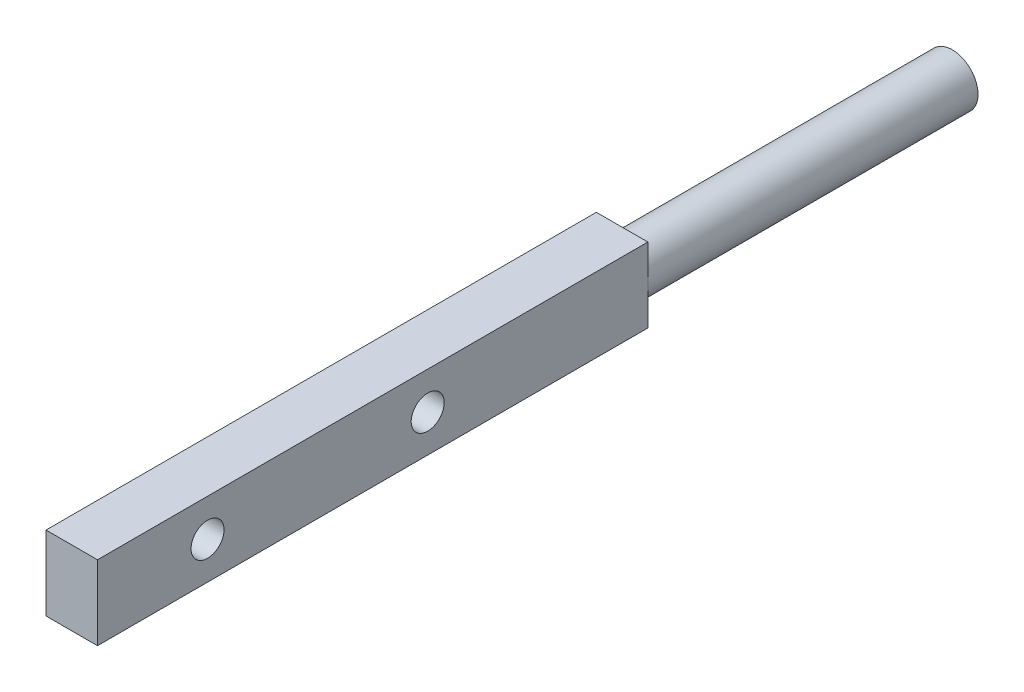
from build123d import *

# Parameters (mm, degrees)
SKETCH1_W           = 4.67766733
SKETCH1_H           = 6.76462661
BOSS_EXTRUDE1_DEPTH = 50
SKETCH2_R           = 2.338833665
BOSS_EXTRUDE2_DEPTH = 30
SKETCH3_R           = 1.5
CUT_EXTRUDE1_DEPTH  = 51.671893046


with BuildPart() as part:
    # Sketch1 → Boss-Extrude1 (new body)
    with BuildSketch(Plane.XY):
        with Locations((2.338833665, 3.382313305)):
            Rectangle(SKETCH1_W, SKETCH1_H)
    extrude(amount=BOSS_EXTRUDE1_DEPTH)

    # Sketch2 → Boss-Extrude2 (add)
    with BuildSketch(Plane(origin=(0, 0, 0), x_dir=(-1, 0, 0), z_dir=(0, 0, -1))):
        with Locations((-2.338833665, 3.382313305)):
            Circle(SKETCH2_R)
    extrude(amount=BOSS_EXTRUDE2_DEPTH)

    # Sketch3 → Cut-Extrude1 (cut, through all)
    with BuildSketch(Plane(origin=(4.67766733, 0, 0), x_dir=(0, 0, -1), z_dir=(1, 0, 0))):
        with Locations((-20, 3.382313305)):
            Circle(SKETCH3_R)
        with Locations((-40, 3.382313305)):
            Circle(SKETCH3_R)
    extrude(amount=-CUT_EXTRUDE1_DEPTH, mode=Mode.SUBTRACT)


solid = part.part
